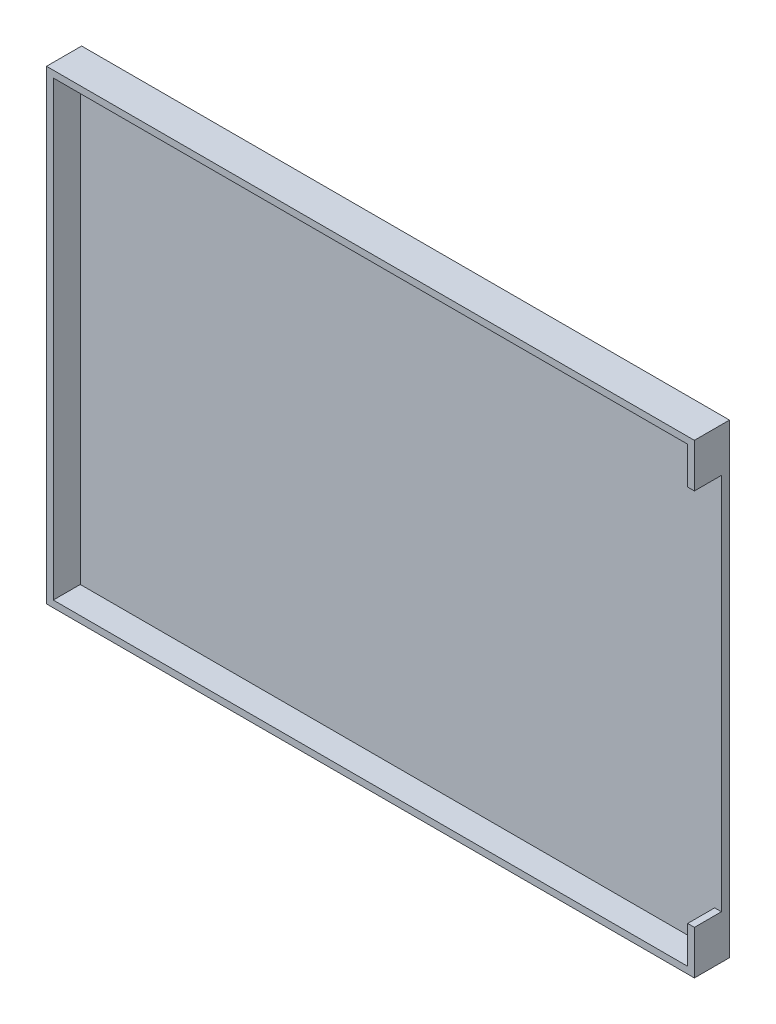
from build123d import *

# Parameters (mm, degrees)
SKETCH_1_W      = 48
SKETCH_1_H      = 34.5
EXTRUDE_1_DEPTH = 0.6
EXTRUDE_2_DEPTH = 2


with BuildPart() as part:
    # Эскиз1 → Бобышка-Вытянуть1 (new body)
    with BuildSketch(Plane.XY):
        Rectangle(SKETCH_1_W, SKETCH_1_H)
    extrude(amount=EXTRUDE_1_DEPTH)

    # Эскиз2 → Бобышка-Вытянуть2 (add)
    with BuildSketch(Plane.XY.offset(0.6)):
        Polygon((24, 17.25), (-24, 17.25), (-24, -17.25), (24, -17.25), (24, -14), (23.5, -14), (23.5, -16.75), (-23.5, -16.75), (-23.5, 16.75), (23.5, 16.75), (23.5, 14), (24, 14), align=None)
    extrude(amount=EXTRUDE_2_DEPTH)


solid = part.part
